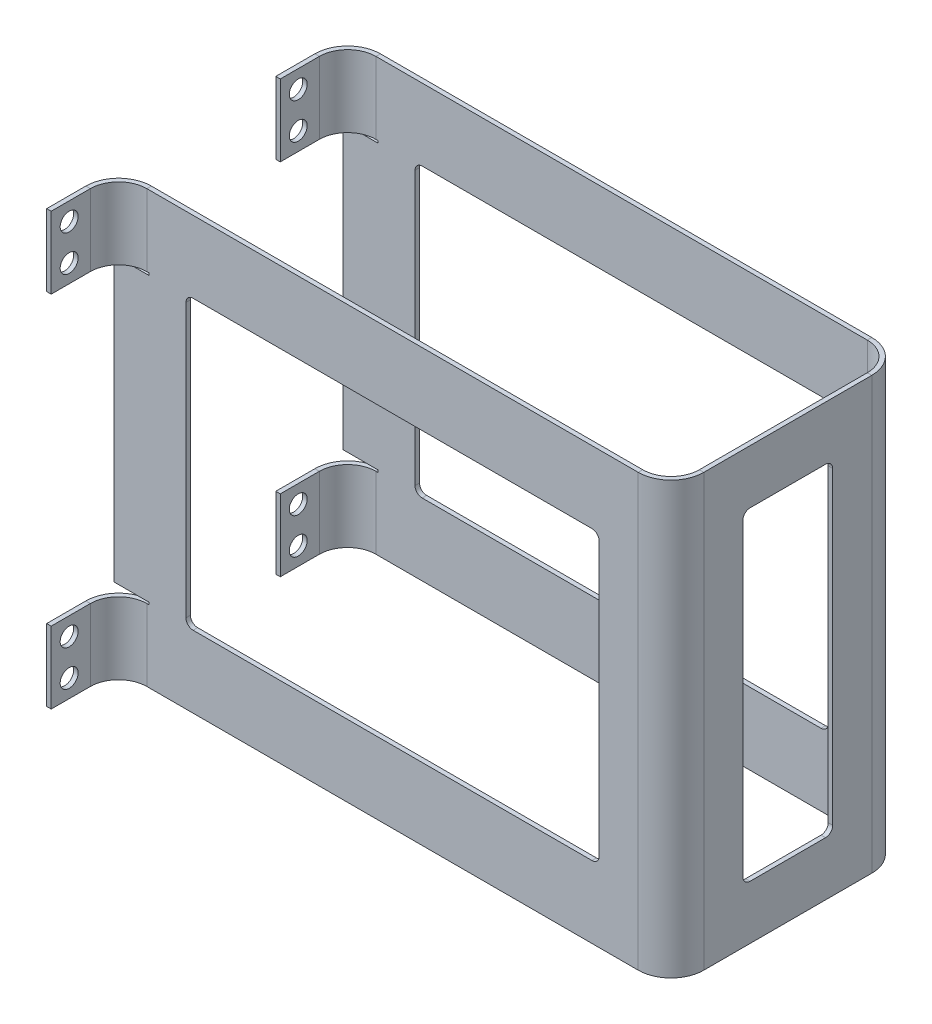
from build123d import *

# Parameters (mm, degrees)
SKETCH1_W                     = 196.85
SKETCH1_H                     = 152.4
SKETCH1_W_2                   = 146.05
SKETCH1_H_2                   = 101.6
BOSS_EXTRUDE1_DEPTH           = 1.5875
EDGE_FLANGE1_STRIP_W          = 26.35
EDGE_FLANGE1_STRIP_H          = 1.5875
EDGE_FLANGE1_STRIP_CUT_DEPTH  = 152.4
EDGE_FLANGE1_DEPTH            = 152.4
EDGE_FLANGE2_STRIP_W          = 26.35
EDGE_FLANGE2_STRIP_H          = 1.5875
EDGE_FLANGE2_STRIP_CUT_DEPTH  = 152.4
EDGE_FLANGE2_DEPTH            = 152.4
SKETCH16_W                    = 146.05
SKETCH16_H                    = 101.6
CUT_EXTRUDE1_DEPTH            = 1.5875
SKETCH17_W                    = 31.75
SKETCH17_H                    = 114.3
CUT_EXTRUDE2_DEPTH            = 1.5875
SKETCH25_W                    = 1.5875
SKETCH25_H                    = 101.6
CUT_EXTRUDE3_DEPTH            = 0.0254
EDGE_FLANGE5_STRIP_W          = 26.35
EDGE_FLANGE5_STRIP_H          = 1.5875
EDGE_FLANGE5_STRIP_CUT_DEPTH  = 25.4
EDGE_FLANGE5_RELIEF_W         = 27.14375
EDGE_FLANGE5_RELIEF_H         = 0.79375
EDGE_FLANGE5_RELIEF_CUT_DEPTH = 1.5875
EDGE_FLANGE5_DEPTH            = 25.4
EDGE_FLANGE6_STRIP_W          = 26.35
EDGE_FLANGE6_STRIP_H          = 1.5875
EDGE_FLANGE6_STRIP_CUT_DEPTH  = 25.4
EDGE_FLANGE6_RELIEF_W         = 27.14375
EDGE_FLANGE6_RELIEF_H         = 0.79375
EDGE_FLANGE6_RELIEF_CUT_DEPTH = 1.5875
EDGE_FLANGE6_DEPTH            = 25.4
SKETCH32_R                    = 3.175
CUT_EXTRUDE4_DEPTH            = 10.16
SKETCH33_R                    = 3.175
CUT_EXTRUDE5_DEPTH            = 10.16
FILLET1_R                     = 2.54
FILLET2_R                     = 2.54
FILLET3_R                     = 2.54
SKETCH35_W                    = 1.5875
SKETCH35_H                    = 101.6
CUT_EXTRUDE6_DEPTH            = 0.0254
EDGE_FLANGE7_STRIP_W          = 26.35
EDGE_FLANGE7_STRIP_H          = 1.5875
EDGE_FLANGE7_STRIP_CUT_DEPTH  = 25.4
EDGE_FLANGE7_RELIEF_W         = 27.14375
EDGE_FLANGE7_RELIEF_H         = 0.79375
EDGE_FLANGE7_RELIEF_CUT_DEPTH = 1.5875
EDGE_FLANGE7_DEPTH            = 25.4
EDGE_FLANGE8_STRIP_W          = 26.35
EDGE_FLANGE8_STRIP_H          = 1.5875
EDGE_FLANGE8_STRIP_CUT_DEPTH  = 25.4
EDGE_FLANGE8_RELIEF_W         = 27.14375
EDGE_FLANGE8_RELIEF_H         = 0.79375
EDGE_FLANGE8_RELIEF_CUT_DEPTH = 1.5875
EDGE_FLANGE8_DEPTH            = 25.4
SKETCH42_R                    = 3.175
CUT_EXTRUDE7_DEPTH            = 10.16
SKETCH43_R                    = 3.175
CUT_EXTRUDE8_DEPTH            = 10.16


# Sheet-metal steps are written as plain solids
with BuildPart() as part:
    # Sketch1 → Boss-Extrude1 (new body)
    with BuildSketch(Plane.XY):
        with Locations((-98.425, 76.2)):
            Rectangle(SKETCH1_W, SKETCH1_H)
        with Locations((-98.425, 76.2)):
            Rectangle(SKETCH1_W_2, SKETCH1_H_2, mode=Mode.SUBTRACT)
    extrude(amount=BOSS_EXTRUDE1_DEPTH)

    # Edge-Flange1 strip (across the edge) → Edge-Flange1 strip cut (cut)
    with BuildSketch(Plane(origin=(0, 152.4, 0), x_dir=(-1, 0, 0), z_dir=(0, -1, 0))):
        with Locations((-1.5875, -0.79375)):
            Rectangle(EDGE_FLANGE1_STRIP_W, EDGE_FLANGE1_STRIP_H)
    extrude(amount=EDGE_FLANGE1_STRIP_CUT_DEPTH, mode=Mode.SUBTRACT)

    # Edge-Flange1 section (across the edge) → Edge-Flange1 (add)
    with BuildSketch(Plane(origin=(0, 152.4, 0), x_dir=(-1, 0, 0), z_dir=(0, -1, 0))):
        with BuildLine():
            Line((0, 10), (0, 80.9625))
            Line((0, 80.9625), (1.5875, 80.9625))
            Line((1.5875, 80.9625), (1.5875, 10))
            ThreePointArc((1.5875, 10), (4.516432188, 2.928932188), (11.5875, 0))
            Line((11.5875, 0), (11.5875, -1.5875))
            ThreePointArc((11.5875, -1.5875), (3.393900173, 1.806400173), (0, 10))
        make_face()
    extrude(amount=EDGE_FLANGE1_DEPTH)

    # Edge-Flange2 strip (across the edge) → Edge-Flange2 strip cut (cut)
    with BuildSketch(Plane(origin=(-1.5875, 152.4, -80.9625), x_dir=(0, 0, 1), z_dir=(0, -1, 0))):
        with Locations((-1.5875, -0.79375)):
            Rectangle(EDGE_FLANGE2_STRIP_W, EDGE_FLANGE2_STRIP_H)
    extrude(amount=EDGE_FLANGE2_STRIP_CUT_DEPTH, mode=Mode.SUBTRACT)

    # Edge-Flange2 section (across the edge) → Edge-Flange2 (add)
    with BuildSketch(Plane(origin=(-1.5875, 152.4, -80.9625), x_dir=(0, 0, 1), z_dir=(0, -1, 0))):
        with BuildLine():
            Line((0, 10), (0, 195.2625))
            Line((0, 195.2625), (1.5875, 195.2625))
            Line((1.5875, 195.2625), (1.5875, 10))
            ThreePointArc((1.5875, 10), (4.516432188, 2.928932188), (11.5875, 0))
            Line((11.5875, 0), (11.5875, -1.5875))
            ThreePointArc((11.5875, -1.5875), (3.393900173, 1.806400173), (0, 10))
        make_face()
    extrude(amount=EDGE_FLANGE2_DEPTH)

    # Sketch16 → Cut-Extrude1 (cut)
    with BuildSketch(Plane(origin=(0, 0, -80.9625), x_dir=(-1, 0, 0), z_dir=(0, 0, -1))):
        with Locations((98.425, 76.2)):
            Rectangle(SKETCH16_W, SKETCH16_H)
    extrude(amount=-CUT_EXTRUDE1_DEPTH, mode=Mode.SUBTRACT)

    # Sketch17 → Cut-Extrude2 (cut)
    with BuildSketch(Plane.ZY.offset(1.5875)):
        with Locations((-39.6875, 76.2)):
            Rectangle(SKETCH17_W, SKETCH17_H)
    extrude(amount=-CUT_EXTRUDE2_DEPTH, mode=Mode.SUBTRACT)

    # Sketch25 → Cut-Extrude3 (cut)
    with BuildSketch(Plane.ZY.offset(196.85)):
        with Locations((-80.16875, 76.2)):
            Rectangle(SKETCH25_W, SKETCH25_H)
    extrude(amount=-CUT_EXTRUDE3_DEPTH, mode=Mode.SUBTRACT)

    # Edge-Flange5 strip (across the edge) → Edge-Flange5 strip cut (cut)
    with BuildSketch(Plane(origin=(-196.85, 152.4, -79.375), x_dir=(1, 0, 0), z_dir=(0, -1, 0))):
        with Locations((-1.5875, -0.79375)):
            Rectangle(EDGE_FLANGE5_STRIP_W, EDGE_FLANGE5_STRIP_H)
    extrude(amount=EDGE_FLANGE5_STRIP_CUT_DEPTH, mode=Mode.SUBTRACT)

    # Edge-Flange5 relief (on the sheet) → Edge-Flange5 relief cut (cut)
    with BuildSketch(Plane(origin=(-185.2625, 152.4, -79.375), x_dir=(1, 0, 0), z_dir=(0, 0, 1))):
        with Locations((-12.778125, -25.796875)):
            Rectangle(EDGE_FLANGE5_RELIEF_W, EDGE_FLANGE5_RELIEF_H)
    extrude(amount=-EDGE_FLANGE5_RELIEF_CUT_DEPTH, mode=Mode.SUBTRACT)

    # Edge-Flange5 section (across the edge) → Edge-Flange5 (add)
    with BuildSketch(Plane(origin=(-196.85, 152.4, -79.375), x_dir=(1, 0, 0), z_dir=(0, -1, 0))):
        with BuildLine():
            Line((0, 10), (0, 23.8125))
            Line((0, 23.8125), (1.5875, 23.8125))
            Line((1.5875, 23.8125), (1.5875, 10))
            ThreePointArc((1.5875, 10), (4.516432188, 2.928932188), (11.5875, 0))
            Line((11.5875, 0), (11.5875, -1.5875))
            ThreePointArc((11.5875, -1.5875), (3.393900173, 1.806400173), (0, 10))
        make_face()
    extrude(amount=EDGE_FLANGE5_DEPTH)

    # Edge-Flange6 strip (across the edge) → Edge-Flange6 strip cut (cut)
    with BuildSketch(Plane(origin=(-196.85, 25.4, -79.375), x_dir=(1, 0, 0), z_dir=(0, -1, 0))):
        with Locations((-1.5875, -0.79375)):
            Rectangle(EDGE_FLANGE6_STRIP_W, EDGE_FLANGE6_STRIP_H)
    extrude(amount=EDGE_FLANGE6_STRIP_CUT_DEPTH, mode=Mode.SUBTRACT)

    # Edge-Flange6 relief (on the sheet) → Edge-Flange6 relief cut (cut)
    with BuildSketch(Plane(origin=(-185.2625, 25.4, -79.375), x_dir=(1, 0, 0), z_dir=(0, 0, 1))):
        with Locations((-12.778125, 0.396875)):
            Rectangle(EDGE_FLANGE6_RELIEF_W, EDGE_FLANGE6_RELIEF_H)
    extrude(amount=-EDGE_FLANGE6_RELIEF_CUT_DEPTH, mode=Mode.SUBTRACT)

    # Edge-Flange6 section (across the edge) → Edge-Flange6 (add)
    with BuildSketch(Plane(origin=(-196.85, 25.4, -79.375), x_dir=(1, 0, 0), z_dir=(0, -1, 0))):
        with BuildLine():
            Line((0, 10), (0, 23.8125))
            Line((0, 23.8125), (1.5875, 23.8125))
            Line((1.5875, 23.8125), (1.5875, 10))
            ThreePointArc((1.5875, 10), (4.516432188, 2.928932188), (11.5875, 0))
            Line((11.5875, 0), (11.5875, -1.5875))
            ThreePointArc((11.5875, -1.5875), (3.393900173, 1.806400173), (0, 10))
        make_face()
    extrude(amount=EDGE_FLANGE6_DEPTH)

    # Sketch32 → Cut-Extrude4 (cut)
    with BuildSketch(Plane.ZY.offset(196.85)):
        with Locations((-61.9125, 146.05)):
            Circle(SKETCH32_R)
        with Locations((-61.9125, 133.35)):
            Circle(SKETCH32_R)
    extrude(amount=-CUT_EXTRUDE4_DEPTH, mode=Mode.SUBTRACT)

    # Sketch33 → Cut-Extrude5 (cut)
    with BuildSketch(Plane.ZY.offset(196.85)):
        with Locations((-61.9125, 19.05)):
            Circle(SKETCH33_R)
        with Locations((-61.9125, 6.35)):
            Circle(SKETCH33_R)
    extrude(amount=-CUT_EXTRUDE5_DEPTH, mode=Mode.SUBTRACT)

    # Fillet1
    fillet1_edges = [part.edges().sort_by_distance(p)[0] for p in [
        (-25.4, 127, 0.79375),
    ]]
    fillet(fillet1_edges, radius=FILLET1_R)

    # Fillet2
    fillet2_edges = [part.edges().sort_by_distance(p)[0] for p in [
        (-171.45, 25.4, 0.79375),
        (-25.4, 25.4, 0.79375),
        (-171.45, 127, 0.79375),
        (-25.4, 25.4, -80.16875),
        (-25.4, 127, -80.16875),
        (-171.45, 127, -80.16875),
    ]]
    fillet(fillet2_edges, radius=FILLET2_R)

    # Fillet3
    fillet3_edges = [part.edges().sort_by_distance(p)[0] for p in [
        (-0.79375, 19.05, -55.5625),
        (-0.79375, 133.35, -55.5625),
        (-0.79375, 133.35, -23.8125),
        (-0.79375, 19.05, -23.8125),
        (-171.45, 25.4, -80.16875),
    ]]
    fillet(fillet3_edges, radius=FILLET3_R)

    # Sketch35 → Cut-Extrude6 (cut)
    with BuildSketch(Plane.ZY.offset(196.85)):
        with Locations((0.79375, 76.2)):
            Rectangle(SKETCH35_W, SKETCH35_H)
    extrude(amount=-CUT_EXTRUDE6_DEPTH, mode=Mode.SUBTRACT)

    # Edge-Flange7 strip (across the edge) → Edge-Flange7 strip cut (cut)
    with BuildSketch(Plane(origin=(-196.85, 152.4, 1.5875), x_dir=(1, 0, 0), z_dir=(0, -1, 0))):
        with Locations((-1.5875, -0.79375)):
            Rectangle(EDGE_FLANGE7_STRIP_W, EDGE_FLANGE7_STRIP_H)
    extrude(amount=EDGE_FLANGE7_STRIP_CUT_DEPTH, mode=Mode.SUBTRACT)

    # Edge-Flange7 relief (on the sheet) → Edge-Flange7 relief cut (cut)
    with BuildSketch(Plane(origin=(-185.2625, 152.4, 1.5875), x_dir=(1, 0, 0), z_dir=(0, 0, 1))):
        with Locations((-12.778125, -25.796875)):
            Rectangle(EDGE_FLANGE7_RELIEF_W, EDGE_FLANGE7_RELIEF_H)
    extrude(amount=-EDGE_FLANGE7_RELIEF_CUT_DEPTH, mode=Mode.SUBTRACT)

    # Edge-Flange7 section (across the edge) → Edge-Flange7 (add)
    with BuildSketch(Plane(origin=(-196.85, 152.4, 1.5875), x_dir=(1, 0, 0), z_dir=(0, -1, 0))):
        with BuildLine():
            Line((0, 10), (0, 23.8125))
            Line((0, 23.8125), (1.5875, 23.8125))
            Line((1.5875, 23.8125), (1.5875, 10))
            ThreePointArc((1.5875, 10), (4.516432188, 2.928932188), (11.5875, 0))
            Line((11.5875, 0), (11.5875, -1.5875))
            ThreePointArc((11.5875, -1.5875), (3.393900173, 1.806400173), (0, 10))
        make_face()
    extrude(amount=EDGE_FLANGE7_DEPTH)

    # Edge-Flange8 strip (across the edge) → Edge-Flange8 strip cut (cut)
    with BuildSketch(Plane(origin=(-196.85, 25.4, 1.5875), x_dir=(1, 0, 0), z_dir=(0, -1, 0))):
        with Locations((-1.5875, -0.79375)):
            Rectangle(EDGE_FLANGE8_STRIP_W, EDGE_FLANGE8_STRIP_H)
    extrude(amount=EDGE_FLANGE8_STRIP_CUT_DEPTH, mode=Mode.SUBTRACT)

    # Edge-Flange8 relief (on the sheet) → Edge-Flange8 relief cut (cut)
    with BuildSketch(Plane(origin=(-185.2625, 25.4, 1.5875), x_dir=(1, 0, 0), z_dir=(0, 0, 1))):
        with Locations((-12.778125, 0.396875)):
            Rectangle(EDGE_FLANGE8_RELIEF_W, EDGE_FLANGE8_RELIEF_H)
    extrude(amount=-EDGE_FLANGE8_RELIEF_CUT_DEPTH, mode=Mode.SUBTRACT)

    # Edge-Flange8 section (across the edge) → Edge-Flange8 (add)
    with BuildSketch(Plane(origin=(-196.85, 25.4, 1.5875), x_dir=(1, 0, 0), z_dir=(0, -1, 0))):
        with BuildLine():
            Line((0, 10), (0, 23.8125))
            Line((0, 23.8125), (1.5875, 23.8125))
            Line((1.5875, 23.8125), (1.5875, 10))
            ThreePointArc((1.5875, 10), (4.516432188, 2.928932188), (11.5875, 0))
            Line((11.5875, 0), (11.5875, -1.5875))
            ThreePointArc((11.5875, -1.5875), (3.393900173, 1.806400173), (0, 10))
        make_face()
    extrude(amount=EDGE_FLANGE8_DEPTH)

    # Sketch42 → Cut-Extrude7 (cut)
    with BuildSketch(Plane.ZY.offset(196.85)):
        with Locations((19.05, 146.05)):
            Circle(SKETCH42_R)
        with Locations((19.05, 133.35)):
            Circle(SKETCH42_R)
    extrude(amount=-CUT_EXTRUDE7_DEPTH, mode=Mode.SUBTRACT)

    # Sketch43 → Cut-Extrude8 (cut)
    with BuildSketch(Plane.ZY.offset(196.85)):
        with Locations((19.05, 19.05)):
            Circle(SKETCH43_R)
        with Locations((19.05, 6.35)):
            Circle(SKETCH43_R)
    extrude(amount=-CUT_EXTRUDE8_DEPTH, mode=Mode.SUBTRACT)


solid = part.part
